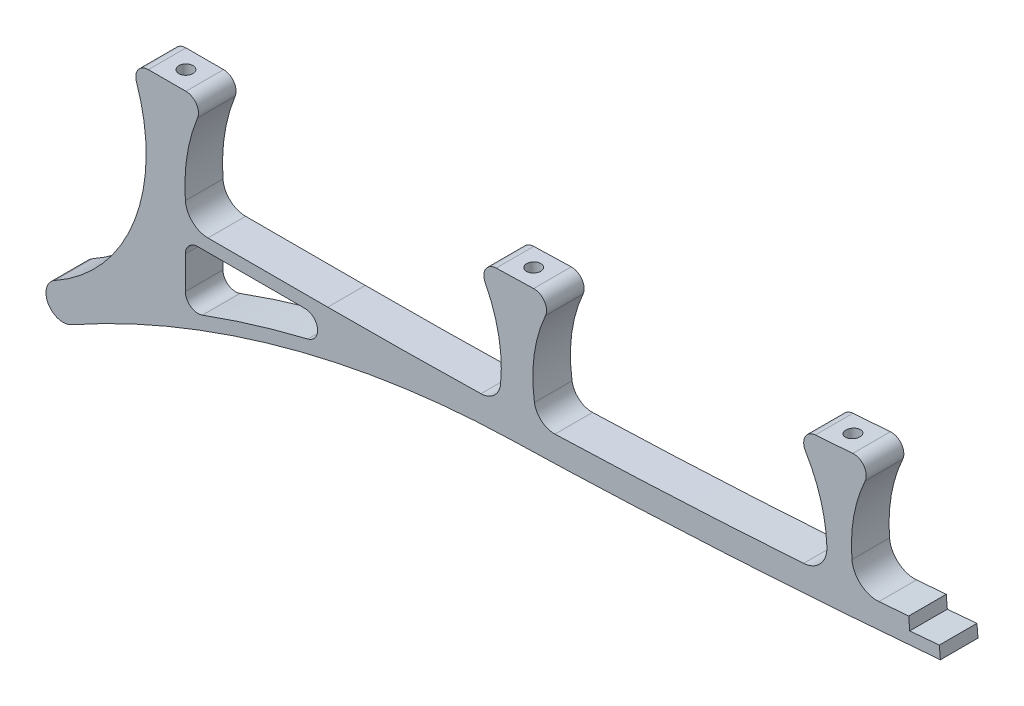
from build123d import *

# Parameters (mm, degrees)
BOSS_EXTRUDE5_START      = -4.7625
BOSS_EXTRUDE5_DEPTH      = 9.525
SKETCH6_R                = 1.778
CUT_EXTRUDE3_DEPTH       = 504.713812734
SKETCH10_R               = 1.778
CUT_EXTRUDE6_DEPTH       = 502.305899638
CUT_EXTRUDE11_DEPTH      = 3.556
CUT_EXTRUDE11_DEPTH_BACK = 499.029405252
SKETCH12_R               = 3.175
SKETCH13_R               = 1.778
CUT_EXTRUDE12_DEPTH      = 500.236768439
SKETCH14_R               = 3.175
CUT_EXTRUDE13_DEPTH      = 19.05
CUT_EXTRUDE14_DEPTH      = 3.556
CUT_EXTRUDE14_DEPTH_BACK = 502.047726259
SKETCH16_R               = 3.175
CUT_EXTRUDE15_START      = -9.525
CUT_EXTRUDE15_DEPTH      = 9.525


# Read off the part's stored shape, not the designer's step: Boss-Extrude5, Cut-Extrude15
with BuildPart() as part:
    # Boss-Extrude5 outline → Boss-Extrude5 (new body)
    with BuildSketch(Plane(origin=(0, 0, 4.097149242), x_dir=(-1, 0, 0), z_dir=(0, 0, -1)).offset(BOSS_EXTRUDE5_START)):
        with BuildLine():
            Line((275.968535621, -57.45686485), (268.466452075, -56.806773151))
            Line((268.466452075, -56.806773151), (268.19701998, -59.916030026))
            add(Edge.make_bspline(
                [(268.19701998, -59.916030026), (268.301513894, -59.925084927), (271.460895726, -60.19858153), (277.676804899, -60.720078346), (287.936274788, -61.527892452), (307.662146031, -62.961314107), (336.878063452, -64.674562273), (362.299459592, -65.630758689), (375.34563844, -65.980821156), (376.009263562, -65.998351659), (376.506986395, -66.011361482), (376.838803336, -66.019942665), (377.004712591, -66.024210248)],
                knots=[0.337983756, 0.337983756, 0.337983756, 0.337983756, 0.338649363, 0.358108739, 0.377568116, 0.403957689, 0.483619427, 0.563281166, 0.565387596, 0.566440812, 0.567494027, 0.568547243, 0.568547243, 0.568547243, 0.568547243], degree=3))
            ThreePointArc((377.004712591, -66.024210248), (434.484295389, -74.49501479), (488.276522854, -96.450725494))
            ThreePointArc((488.276522854, -96.450725494), (494.19519795, -94.762435803), (492.499924864, -88.845757162))
            ThreePointArc((492.499924864, -88.845757162), (472.347982204, -65.669309605), (471.824439099, -34.961421092))
            ThreePointArc((471.824439099, -34.961421092), (471.408544547, -32.082865726), (468.823110549, -30.750731982))
            Line((468.823110549, -30.750731982), (459.298110549, -30.750731982))
            ThreePointArc((459.298110549, -30.750731982), (456.664489609, -32.15241144), (456.356218194, -35.119840174))
            ThreePointArc((456.356218194, -35.119840174), (459.038549003, -44.793404021), (459.444428928, -54.823757832))
            ThreePointArc((459.444428928, -54.823757832), (457.624194748, -58.605108853), (453.717728119, -60.138531982))
            Line((453.717728119, -60.138531982), (423.379813153, -60.138532201))
            add(Edge.make_bspline(
                [(384.561436501, -59.721923859), (385.342635212, -59.738787815), (398.280332925, -60.009594345), (411.224581778, -60.140000907), (423.379813153, -60.138532201)],
                knots=[0.584240942, 0.584240942, 0.584240942, 0.584240942, 0.589217583, 0.666659111, 0.666659111, 0.666659111, 0.666659111], degree=3))
            ThreePointArc((384.561436501, -59.721923859), (381.203597368, -58.363400914), (379.593520206, -55.118663672))
            ThreePointArc((379.593520206, -55.118663672), (380.07016651, -44.713375232), (383.473239108, -34.868766752))
            ThreePointArc((383.473239108, -34.868766752), (383.382771388, -31.793732831), (380.728271975, -30.238853129))
            add(Edge.make_bspline(
                [(371.223837985, -29.983824335), (374.39174563, -30.077394979), (377.559905672, -30.162404856), (380.728271975, -30.238853129)],
                knots=[0.554073124, 0.554073124, 0.554073124, 0.554073124, 0.574595609, 0.574595609, 0.574595609, 0.574595609], degree=3))
            ThreePointArc((371.223837985, -29.983824335), (368.489785186, -31.39412107), (368.234547952, -34.459873245))
            ThreePointArc((368.234547952, -34.459873245), (371.104790651, -44.472811018), (371.022751, -54.88868758))
            ThreePointArc((371.022751, -54.88868758), (369.240986237, -58.042412825), (365.815125645, -59.218910906))
            add(Edge.make_bspline(
                [(302.861547137, -56.088038468), (305.811031553, -56.28688123), (317.379618611, -57.037979008), (337.579863558, -58.152389447), (355.620822681, -58.885705677), (365.034145822, -59.193857367), (365.815125645, -59.218910906)],
                knots=[0.410604965, 0.410604965, 0.410604965, 0.410604965, 0.429432973, 0.484442087, 0.539451201, 0.544427837, 0.544427837, 0.544427837, 0.544427837], degree=3))
            ThreePointArc((302.861547137, -56.088038468), (298.580567699, -54.010676189), (296.944813444, -49.54228442))
            ThreePointArc((296.944813444, -49.54228442), (298.48456489, -40.039989376), (302.371739219, -31.23349624))
            ThreePointArc((302.371739219, -31.23349624), (302.471812822, -28.129850677), (299.876260243, -26.425228339))
            add(Edge.make_bspline(
                [(290.39363306, -25.733255912), (293.55387775, -25.972454095), (296.714768824, -26.203112639), (299.876260243, -26.425228339)],
                knots=[0.379346778, 0.379346778, 0.379346778, 0.379346778, 0.39986924, 0.39986924, 0.39986924, 0.39986924], degree=3))
            ThreePointArc((290.39363306, -25.733255912), (287.546704938, -27.087400093), (287.270368838, -30.227837094))
            ThreePointArc((287.270368838, -30.227837094), (290.158173856, -39.457070008), (290.605029929, -49.117218954))
            ThreePointArc((290.605029929, -49.117218954), (288.384368096, -53.437608207), (283.759752935, -54.924227487))
            Line((283.759752935, -54.924227487), (276.225556942, -54.309054203))
            Line((276.225556942, -54.309054203), (275.968535621, -57.45686485))
        make_face()
    extrude(amount=BOSS_EXTRUDE5_DEPTH)

    # Sketch6 → Cut-Extrude3 (cut, through all)
    with BuildSketch(Plane(origin=(0.329719812, -4.518402653, 0), x_dir=(0.9973480826532571, 0.07277913181587167, 0), z_dir=(-0.07277913181587167, 0.9973480826532571, 0))):
        with Locations(Location((-296.227216633, -4.097149242, 0), (0, 0, 180))):
            Circle(SKETCH6_R)
    extrude(amount=-CUT_EXTRUDE3_DEPTH, mode=Mode.SUBTRACT)

    # Sketch10 → Cut-Extrude6 (cut, through all)
    with BuildSketch(Plane(origin=(0.536880971, -20.008501524, 0), x_dir=(0.9996401989225796, 0.02682298823818541, 0), z_dir=(-0.02682298823818541, 0.9996401989225796, 0))):
        with Locations(Location((-376.648454476, -4.097149242, 0), (0, 0, 180))):
            Circle(SKETCH10_R)
    extrude(amount=-CUT_EXTRUDE6_DEPTH, mode=Mode.SUBTRACT)

    # Sketch12 → Cut-Extrude11 (cut, two sides: drawn at the far end of the back side and taken through both)
    with BuildSketch(Plane(origin=(1.49547556, -55.733443025, 0), x_dir=(0.9996401989225796, 0.02682298823818541, 0), z_dir=(-0.02682298823818541, 0.9996401989225796, 0)).offset(-CUT_EXTRUDE11_DEPTH_BACK)):
        with Locations(Location((-376.656171029, -4.097149242, 0), (0, 0, 180))):
            Circle(SKETCH12_R)
    extrude(amount=CUT_EXTRUDE11_DEPTH + CUT_EXTRUDE11_DEPTH_BACK, mode=Mode.SUBTRACT)

    # Sketch13 → Cut-Extrude12 (cut, through all)
    with BuildSketch(Plane(origin=(0, -30.750731982, 0), x_dir=(1, 0, 0), z_dir=(0, 1, 0))):
        with Locations(Location((-464.060610549, -4.097149242, 0), (0, 0, 270))):
            Circle(SKETCH13_R)
    extrude(amount=-CUT_EXTRUDE12_DEPTH, mode=Mode.SUBTRACT)

    # Sketch14 → Cut-Extrude13 (cut)
    with BuildSketch(Plane(origin=(0, -67.072731982, 0), x_dir=(1, 0, 0), z_dir=(0, 1, 0))):
        with Locations(Location((-464.060610549, -4.097149242, 0), (0, 0, 270))):
            Circle(SKETCH14_R)
    extrude(amount=-CUT_EXTRUDE13_DEPTH, mode=Mode.SUBTRACT)

    # Sketch16 → Cut-Extrude14 (cut, two sides: drawn at the far end of the back side and taken through both)
    with BuildSketch(Plane(origin=(2.825316242, -38.717468408, 0), x_dir=(0.9973480826532571, 0.07277913181587167, 0), z_dir=(-0.07277913181587167, 0.9973480826532571, 0)).offset(-CUT_EXTRUDE14_DEPTH_BACK)):
        with Locations(Location((-296.227216633, -4.097149242, 0), (0, 0, 180))):
            Circle(SKETCH16_R)
    extrude(amount=CUT_EXTRUDE14_DEPTH + CUT_EXTRUDE14_DEPTH_BACK, mode=Mode.SUBTRACT)

    # Cut-Extrude15 outline → Cut-Extrude15 (cut)
    with BuildSketch(Plane.XY.offset(8.859649242).offset(CUT_EXTRUDE15_START)):
        with BuildLine():
            ThreePointArc((-455.130446271, -77.765392477), (-441.88722837, -73.326674178), (-428.412276206, -69.65098313))
            ThreePointArc((-428.412276206, -69.65098313), (-425.977962572, -66.146304208), (-429.169209779, -63.313531984))
            Line((-429.169209779, -63.313531984), (-456.269428929, -63.313531984))
            ThreePointArc((-456.269428929, -63.313531984), (-458.514492959, -64.243467954), (-459.444428928, -66.488531984))
            Line((-459.444428928, -66.488531984), (-459.444428928, -74.753979193))
            ThreePointArc((-459.444428928, -74.753979193), (-458.072640456, -77.384523639), (-455.130446271, -77.765392477))
        make_face()
    extrude(amount=CUT_EXTRUDE15_DEPTH, mode=Mode.SUBTRACT)


solid = part.part
